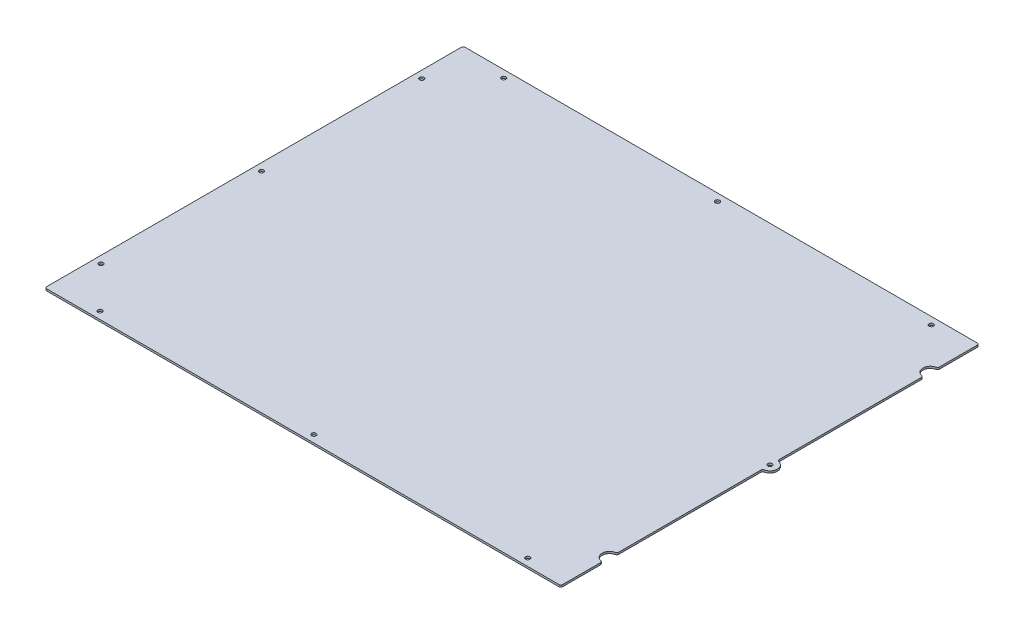
from build123d import *

# Parameters (mm, degrees)
BOSS_EXTRUDE1_DEPTH        = 2.54
F_1_0_228_DIAMETER_HOLE2_D = 5.7912
FILLET2_R                  = 2.54
F_1_0_228_DIAMETER_HOLE3_D = 5.7912


with BuildPart() as part:
    # Sketch1 → Boss-Extrude1 (new body)
    with BuildSketch(Plane(origin=(0, 0, 0), x_dir=(1, 0, 0), z_dir=(0, 1, 0))):
        with BuildLine():
            Line((-341.884, -273.304), (332.232, -273.304))
            Line((332.232, -273.304), (332.232, -219.202))
            ThreePointArc((332.232, -219.202), (322.58, -209.55), (332.232, -199.898))
            Line((332.232, -199.898), (332.232, -9.652))
            ThreePointArc((332.232, -9.652), (341.884, 0), (332.232, 9.652))
            Line((332.232, 9.652), (332.232, 199.898))
            ThreePointArc((332.232, 199.898), (322.58, 209.55), (332.232, 219.202))
            Line((332.232, 219.202), (332.232, 273.304))
            Line((332.232, 273.304), (-341.884, 273.304))
            Line((-341.884, 273.304), (-341.884, -273.304))
        make_face()
    extrude(amount=BOSS_EXTRUDE1_DEPTH)

    # #1 (0.228) Diameter Hole2 (through all)
    with Locations(Plane(origin=(0, 2.54, 0), x_dir=(1, 0, 0), z_dir=(0, 1, 0))):
        with Locations((332.232, 0)):
            Hole(F_1_0_228_DIAMETER_HOLE2_D / 2)

    # Fillet2
    fillet2_edges = [part.edges().sort_by_distance(p)[0] for p in [
        (-341.884, 1.27, -273.304),
        (-341.884, 1.27, 273.304),
        (332.232, 1.27, 273.304),
        (332.232, 1.27, 219.202),
        (332.232, 1.27, 199.898),
        (332.232, 1.27, 9.652),
        (332.232, 1.27, -9.652),
        (332.232, 1.27, -199.898),
        (332.232, 1.27, -219.202),
        (332.232, 1.27, -273.304),
    ]]
    fillet(fillet2_edges, radius=FILLET2_R)

    # #1 (0.228) Diameter Hole3 (through all)
    with Locations(Plane(origin=(0, 2.54, 0), x_dir=(1, 0, 0), z_dir=(0, 1, 0))):
        with Locations((-279.4, 263.652), (-332.232, 209.55), (0, 263.652), (279.4, 263.652), (279.4, -263.652), (0, -263.652), (-279.4, -263.652), (-332.232, -209.55), (-332.232, 0)):
            Hole(F_1_0_228_DIAMETER_HOLE3_D / 2)


solid = part.part
